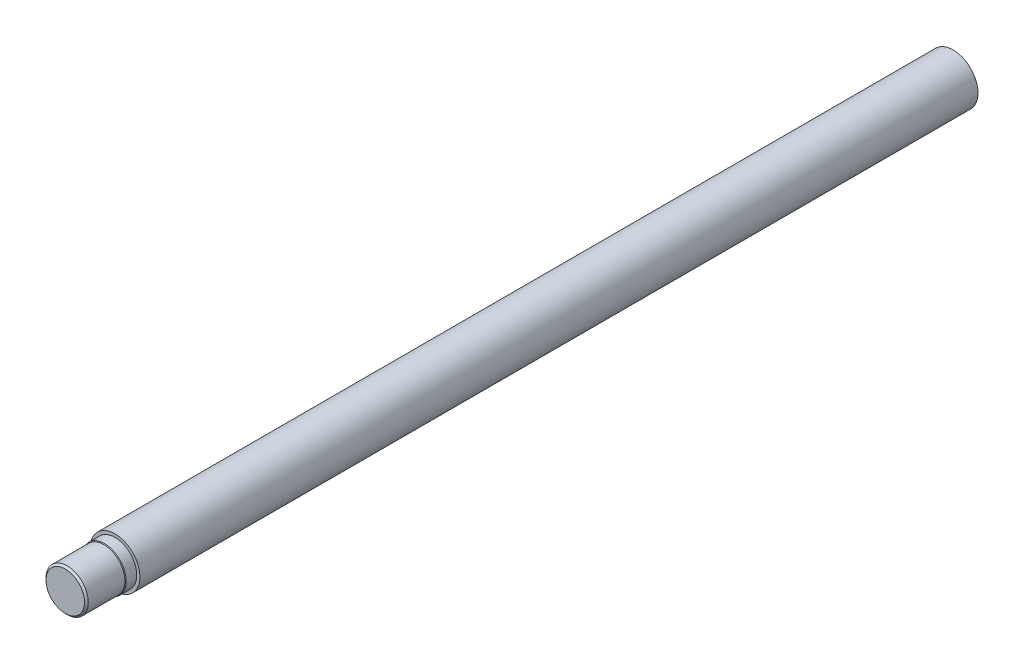
from build123d import *

# Parameters (mm, degrees)
SKETCH1_R           = 40
BOSS_EXTRUDE1_DEPTH = 714
CHAMFER1_SIZE       = 3


with BuildPart() as part:
    # Sketch1 → Boss-Extrude1 (new, symmetric)
    with BuildSketch(Plane.XY):
        Circle(SKETCH1_R)
    extrude(amount=BOSS_EXTRUDE1_DEPTH, both=True)

    # Sketch2 → Cut-Revolve1 (revolve, cut)
    with BuildSketch(Plane(origin=(0, 0, 0), x_dir=(0, 0, -1), z_dir=(1, 0, 0)), mode=Mode.PRIVATE) as cut_revolve1_sk:
        Polygon((-714, 34), (-654, 34), (-654, 35), (-634, 35), (-634, 52.852263241), (-714, 52.852263241), align=None)
    revolve(cut_revolve1_sk.sketch.rotate(Axis((0, 0, 0), (0, 0, 1)), 90), axis=Axis((0, 0, 0), (0, 0, 1)), mode=Mode.SUBTRACT)

    # Chamfer1
    # the kernel refuses this chamfer: 3 mm, written as the material it takes off along each edge
    with BuildSketch(Plane(origin=(0, 0, 654), x_dir=(-1, 0, 0), z_dir=(0, 1, 0))) as chamfer1_piece_1_section:
        Polygon((35, -CHAMFER1_SIZE), (35 - CHAMFER1_SIZE, 0), (35, 0), align=None)
    chamfer1_piece_1 = revolve(axis=Axis((0, 0, 654), (0, 0, 1)), mode=Mode.PRIVATE)
    chamfer1_piece_1 = chamfer1_piece_1 - Plane(origin=(0, 0, 651.51733658), x_dir=(-1, 0, 0), z_dir=(0, 0, -1)) * Cylinder(34, 140, mode=Mode.PRIVATE)
    add(chamfer1_piece_1, mode=Mode.SUBTRACT)
    with BuildSketch(Plane(origin=(0, 0, 714), x_dir=(-1, 0, 0), z_dir=(0, 1, 0))) as chamfer1_piece_2:
        Polygon((34, -CHAMFER1_SIZE), (34 - CHAMFER1_SIZE, 0), (34, 0), align=None)
    revolve(axis=Axis((0, 0, 714), (0, 0, 1)), mode=Mode.SUBTRACT)


solid = part.part
